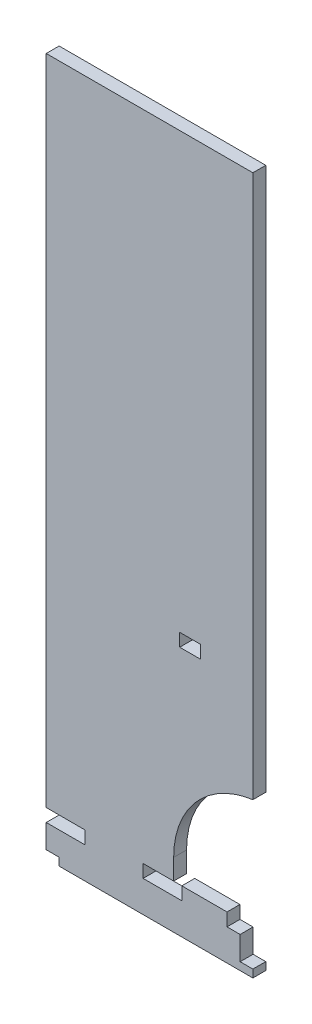
from build123d import *

# Parameters (mm, degrees)
BOSS_EXTRU_1_DEPTH      = 5
ESQUISSE2_W             = 8
ESQUISSE2_H             = 5
ESQUISSE2_W_2           = 15
ESQUISSE2_W_3           = 4.92
ESQUISSE2_H_2           = 3
ENL_V_MAT_EXTRU_1_DEPTH = 5


with BuildPart() as part:
    # Esquisse1 → Boss.-Extru.1 (new body)
    with BuildSketch(Plane.XY):
        with BuildLine():
            Line((0, 0), (80, 0))
            Line((80, 0), (80, 17.15))
            Line((80, 17.15), (49.330858803, 17.15))
            Line((49.330858803, 17.15), (49.330858803, 25.109342079))
            add(Edge.make_bspline(
                [(80, 59.779072791), (49.330858803, 55.600211761), (49.330858803, 25.109342079)],
                knots=[1.708281914, 1.708281914, 1.708281914, 3.141592654, 3.141592654, 3.141592654], degree=2, weights=[1, 0.754006918, 1]))
            Line((80, 59.779072791), (80, 270))
            Line((80, 270), (0, 270))
            Line((0, 270), (0, 0))
        make_face()
    extrude(amount=BOSS_EXTRU_1_DEPTH)

    # Esquisse2 → Enlèv. mat.-Extru.1 (cut)
    with BuildSketch(Plane.XY.offset(5)):
        with Locations((55.679721659, 99.250434868)):
            Rectangle(ESQUISSE2_W, ESQUISSE2_H)
        Polygon((75.08, 12.15), (70, 12.15), (70, 17.15), (80, 17.15), (80, 3), (75.08, 3), align=None)
        with Locations((45, 14.65)):
            Rectangle(ESQUISSE2_W_2, ESQUISSE2_H)
        with Locations((7.5, 14.65)):
            Rectangle(ESQUISSE2_W_2, ESQUISSE2_H)
        with Locations((2.46, 1.5)):
            Rectangle(ESQUISSE2_W_3, ESQUISSE2_H_2)
    extrude(amount=-ENL_V_MAT_EXTRU_1_DEPTH, mode=Mode.SUBTRACT)


solid = part.part
